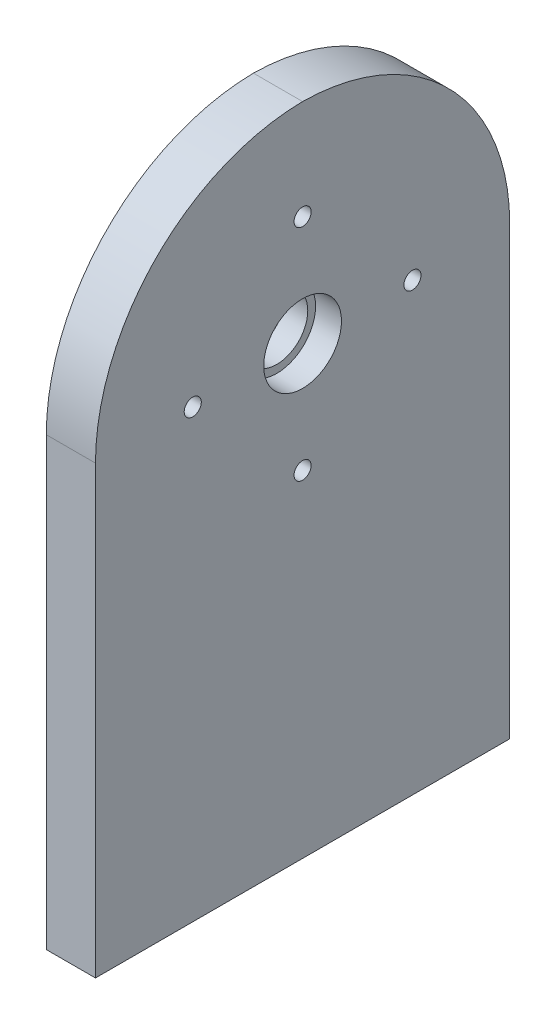
from build123d import *

# Parameters (mm, degrees)
STOCK_NEW_TRACKER_1_START = -68
STOCK_NEW_TRACKER_1_DEPTH = 8
SKETCH1_R                 = 7.5089999999999995
CUT_EXTRUDE1_DEPTH        = 5
SKETCH2_R                 = 6.000000000000002
CUT_EXTRUDE2_DEPTH        = 143.41825129942816
M4X0_7_TAPPED_HOLE1_D     = 3.3
M4X0_7_TAPPED_HOLE1_DEPTH = 35
M4X0_7_TAPPED_HOLE1_TIP   = 0.9914200213954745
M4X0_7_TAPPED_HOLE2_D     = 3.3
SKETCH10_R                = 1.6499999999999984
SKETCH10_R_2              = 1.6499999999999986
SKETCH10_R_3              = 6.000000000000005
BOSS_EXTRUDE1_DEPTH       = 1.5


# Read off the part's stored shape, not the designer's step: Stock-New_Tracker-1
with BuildPart() as part:
    # Stock-New_Tracker-1 outline → Stock-New_Tracker-1 (new body)
    with BuildSketch(Plane.YZ.offset(STOCK_NEW_TRACKER_1_START)):
        with BuildLine():
            Line((10, 40.00000001), (10, -40.00000001))
            Line((10, -40.00000001), (96.116983094, -40.00000001))
            ThreePointArc((96.116983094, -40.00000001), (124.570453888, -28.312888017), (136.594137145, 0))
            ThreePointArc((136.594137145, 0), (124.570453888, 28.312888017), (96.116983094, 40.00000001))
            Line((96.116983094, 40.00000001), (10, 40.00000001))
        make_face()
    extrude(amount=STOCK_NEW_TRACKER_1_DEPTH)

    # Sketch1 → Cut-Extrude1 (cut)
    with BuildSketch(Plane(origin=(-60, 0, 1.041e-14), x_dir=(-1.7e-16, 0, -1), z_dir=(1, 0, -1.7e-16))):
        with Locations((0, 96.11698309434121)):
            Circle(SKETCH1_R)
    extrude(amount=-CUT_EXTRUDE1_DEPTH, mode=Mode.SUBTRACT)

    # Sketch2 → Cut-Extrude2 (cut, through all)
    with BuildSketch(Plane(origin=(-65, 0, 1.128e-14), x_dir=(-1.7e-16, 0, -1), z_dir=(1, 0, -1.7e-16))):
        with Locations((0, 96.11698309434121)):
            Circle(SKETCH2_R)
    extrude(amount=-CUT_EXTRUDE2_DEPTH, mode=Mode.SUBTRACT)

    # M4x0.7 Tapped Hole1
    with Locations(Plane(origin=(0, 10, 0), x_dir=(-1, 0, 0), z_dir=(0, -1, 0))):
        with Locations((64, -30), (64, 0), (64, 30)):
            Hole(M4X0_7_TAPPED_HOLE1_D / 2, depth=M4X0_7_TAPPED_HOLE1_DEPTH)
            with Locations((0, 0, -(M4X0_7_TAPPED_HOLE1_DEPTH + M4X0_7_TAPPED_HOLE1_TIP / 2))):  # 118° drill point
                Cone(0, M4X0_7_TAPPED_HOLE1_D / 2, M4X0_7_TAPPED_HOLE1_TIP, mode=Mode.SUBTRACT)

    # M4x0.7 Tapped Hole2 (through all)
    with Locations(Plane.ZY.offset(67.99999999999999)):
        with Locations((0, 74.903779659), (-21.213203436, 96.116983094), (0, 117.33018653), (21.213203436, 96.116983094)):
            Hole(M4X0_7_TAPPED_HOLE2_D / 2)

    # Sketch10 → Boss-Extrude1 (add)
    with BuildSketch(Plane.ZY.offset(67.99999999999999)):
        with BuildLine():
            Line((40.00000000999996, 10), (40.00000000999996, 96.11698309434121))
            ThreePointArc((40.00000000999996, 96.11698309434121), (28.312888017242308, 124.57045388794387), (-3.291e-14, 136.59413714461505))
            ThreePointArc((-3.291e-14, 136.59413714461505), (-28.31288801724237, 124.57045388794387), (-40.00000001000003, 96.11698309434121))
            Line((-40.00000001000003, 96.11698309434121), (-40.00000001000003, 10))
            Line((-40.00000001000003, 10), (40.00000000999996, 10))
        make_face()
        with Locations((1.335e-14, 117.33018652993762)):
            Circle(SKETCH10_R, mode=Mode.SUBTRACT)
        with Locations((21.213203435596416, 96.11698309434121)):
            Circle(SKETCH10_R_2, mode=Mode.SUBTRACT)
        with Locations(Location((0, 96.11698309434121, 0), (0, 0, 180))):
            Circle(SKETCH10_R_3, mode=Mode.SUBTRACT)
        with Locations((-21.213203435596416, 96.11698309434121)):
            Circle(SKETCH10_R_2, mode=Mode.SUBTRACT)
        with Locations((1.513e-14, 74.9037796587448)):
            Circle(SKETCH10_R, mode=Mode.SUBTRACT)
    extrude(amount=BOSS_EXTRUDE1_DEPTH)


solid = part.part
